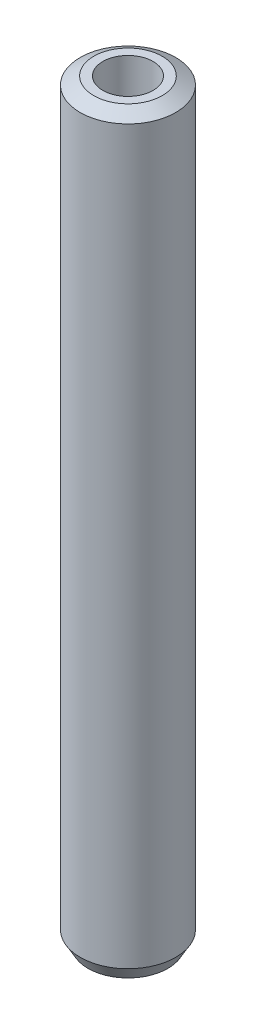
from build123d import *
from OCP.BRepFilletAPI import BRepFilletAPI_MakeChamfer

# Parameters (mm, degrees)
SKETCH1_R           = 25
BOSS_EXTRUDE1_DEPTH = 394.208698013
SKETCH2_R           = 13.157804004
CUT_EXTRUDE1_DEPTH  = 396.790977145
CHAMFER1_SIZE       = 4.098072562
CHAMFER1_SIZE2      = 7.098069891


with BuildPart() as part:
    # Sketch1 → Boss-Extrude1 (new body)
    with BuildSketch(Plane(origin=(0, 0, 0), x_dir=(1, 0, 0), z_dir=(0, 1, 0))):
        Circle(SKETCH1_R)
    extrude(amount=BOSS_EXTRUDE1_DEPTH)

    # Sketch2 → Cut-Extrude1 (cut, through all)
    with BuildSketch(Plane(origin=(0, 0, 0), x_dir=(1, 0, 0), z_dir=(0, 1, 0))):
        Circle(SKETCH2_R)
    extrude(amount=CUT_EXTRUDE1_DEPTH, mode=Mode.SUBTRACT)

    # Chamfer1: one chamfer whose edges measure the first distance from different faces: ONE call of the kernel's chamfer builder (chamfer() names one face for all edges)
    chamfer1_edges_1 = [part.edges().sort_by_distance(p)[0] for p in [
        (-25, 394.208698013, 0),
    ]]
    chamfer1_side_1 = [part.faces().sort_by_distance(p)[0] for p in [
        (-25, 197.104349006, 0),
    ]]
    chamfer1_edges_2 = [part.edges().sort_by_distance(p)[0] for p in [
        (-25, 0, 0),
    ]]
    chamfer1_side_2 = [part.faces().sort_by_distance(p)[0] for p in [
        (-24.292893219, 0, 0),
    ]]
    chamfer1 = BRepFilletAPI_MakeChamfer(part.part.solid().wrapped)
    for e in chamfer1_edges_1:
        chamfer1.Add(CHAMFER1_SIZE, CHAMFER1_SIZE2, e.wrapped, chamfer1_side_1[0].wrapped)  # the first distance lies on this face
    for e in chamfer1_edges_2:
        chamfer1.Add(CHAMFER1_SIZE, CHAMFER1_SIZE2, e.wrapped, chamfer1_side_2[0].wrapped)  # the first distance lies on this face
    add(Compound.cast(chamfer1.Shape()), mode=Mode.REPLACE)


solid = part.part
